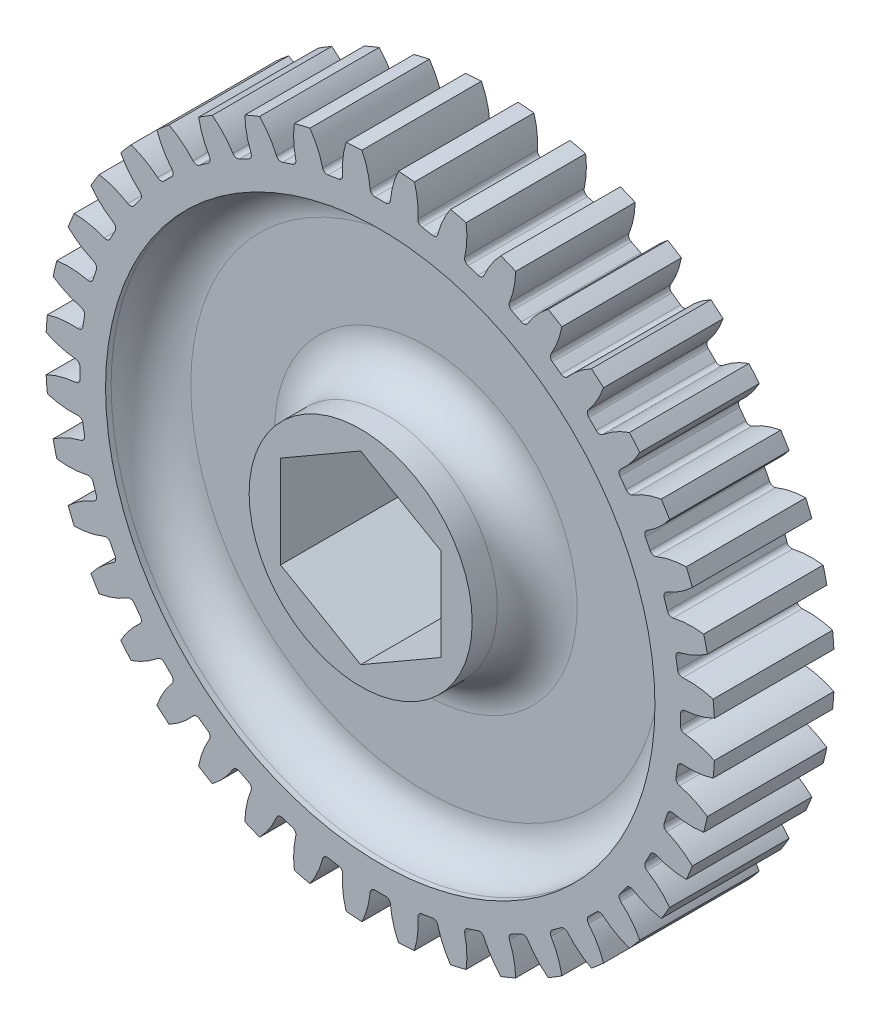
from build123d import *

# Parameters (mm, degrees)
CROQUIS1_R                 = 26.67
SALIENTE_EXTRUIR1_DEPTH    = 4.7625
CORTAR_EXTRUIR1_DEPTH      = 39.016564893
REDONDEO1_R                = 0.381028065
MATRIZC1_COUNT             = 40
REDONDEO1_OF_MATRIZC1_R    = 0.381028065
CROQUIS3_R                 = 8.89
SALIENTE_EXTRUIR2_DEPTH    = 6.3246
CORTAR_EXTRUIR2_DEPTH      = 39.188154981
CORTAR_EXTRUIR2_DEPTH_BACK = 39.188154981
CORTAR_EXTRUIR5_START      = -1.143
CROQUIS7_R                 = 21.8948
CROQUIS7_R_2               = 8.89
CORTAR_EXTRUIR5_DEPTH      = 38.045154981
REDONDEO2_R                = 3.175
REDONDEO2_OF_SIMETR_A1_R   = 3.175


with BuildPart() as part:
    # Croquis1 → Saliente-Extruir1 (new, symmetric)
    with BuildSketch(Plane.XY):
        Circle(CROQUIS1_R)
    extrude(amount=SALIENTE_EXTRUIR1_DEPTH, both=True)

    # Croquis2 → Cortar-Extruir1 (cut, symmetric)
    with BuildSketch(Plane.XY):
        with BuildLine():
            ThreePointArc((0.78662744, 23.917677819), (0, 23.93061), (-0.78662744, 23.917677819))
            ThreePointArc((-0.78662744, 23.917677819), (-0.97917411, 25.309112938), (-1.456570447, 26.630195315))
            ThreePointArc((-1.456570447, 26.630195315), (0, 26.67), (1.456570447, 26.630195315))
            ThreePointArc((1.456570447, 26.630195315), (0.97917411, 25.309112938), (0.78662744, 23.917677819))
        make_face()
    cortar_extruir1 = extrude(amount=CORTAR_EXTRUIR1_DEPTH, both=True, mode=Mode.SUBTRACT)

    # Redondeo1
    redondeo1_edges = [part.edges().sort_by_distance(p)[0] for p in [
        (0.78662744, 23.917677819, 0),
        (-0.78662744, 23.917677819, 0),
    ]]
    fillet(redondeo1_edges, radius=REDONDEO1_R)

    # MatrizC1: Cortar-Extruir1 ×40 about axis
    matrizc1_axis = Axis((0, 0, 4.7625), (0, 0, -1))
    for i in range(1, MATRIZC1_COUNT):
        add(cortar_extruir1.rotate(matrizc1_axis, i * 360 / MATRIZC1_COUNT), mode=Mode.SUBTRACT)

    # Redondeo1 of MatrizC1
    redondeo1_of_matrizc1_edges = [part.edges().sort_by_distance(p)[0] for p in [
        (4.518491885, 23.500155873, 0),
        (2.964606384, 23.746267158, 0),
        (8.139096065, 22.503982097, 0),
        (6.642841759, 22.990144591, 0),
        (11.559288687, 20.953685595, 0),
        (10.157508324, 21.667928365, 0),
        (14.694853258, 18.887439813, 0),
        (13.422063324, 19.81217583, 0),
        (17.468581773, 16.356122579, 0),
        (16.356122579, 17.468581773, 0),
        (19.81217583, 13.422063324, 0),
        (18.887439813, 14.694853258, 0),
        (21.667928365, 10.157508324, 0),
        (20.953685595, 11.559288687, 0),
        (22.990144591, 6.642841759, 0),
        (22.503982097, 8.139096065, 0),
        (23.746267158, 2.964606384, 0),
        (23.500155873, 4.518491885, 0),
        (23.917677819, -0.78662744, 0),
        (23.917677819, 0.78662744, 0),
        (23.500155873, -4.518491885, 0),
        (23.746267158, -2.964606384, 0),
        (22.503982097, -8.139096065, 0),
        (22.990144591, -6.642841759, 0),
        (20.953685595, -11.559288687, 0),
        (21.667928365, -10.157508324, 0),
        (18.887439813, -14.694853258, 0),
        (19.81217583, -13.422063324, 0),
        (16.356122579, -17.468581773, 0),
        (17.468581773, -16.356122579, 0),
        (13.422063324, -19.81217583, 0),
        (14.694853258, -18.887439813, 0),
        (10.157508324, -21.667928365, 0),
        (11.559288687, -20.953685595, 0),
        (6.642841759, -22.990144591, 0),
        (8.139096065, -22.503982097, 0),
        (2.964606384, -23.746267158, 0),
        (4.518491885, -23.500155873, 0),
        (-0.78662744, -23.917677819, 0),
        (0.78662744, -23.917677819, 0),
        (-4.518491885, -23.500155873, 0),
        (-2.964606384, -23.746267158, 0),
        (-8.139096065, -22.503982097, 0),
        (-6.642841759, -22.990144591, 0),
        (-11.559288687, -20.953685595, 0),
        (-10.157508324, -21.667928365, 0),
        (-14.694853258, -18.887439813, 0),
        (-13.422063324, -19.81217583, 0),
        (-17.468581773, -16.356122579, 0),
        (-16.356122579, -17.468581773, 0),
        (-19.81217583, -13.422063324, 0),
        (-18.887439813, -14.694853258, 0),
        (-21.667928365, -10.157508324, 0),
        (-20.953685595, -11.559288687, 0),
        (-22.990144591, -6.642841759, 0),
        (-22.503982097, -8.139096065, 0),
        (-23.746267158, -2.964606384, 0),
        (-23.500155873, -4.518491885, 0),
        (-23.917677819, 0.78662744, 0),
        (-23.917677819, -0.78662744, 0),
        (-23.500155873, 4.518491885, 0),
        (-23.746267158, 2.964606384, 0),
        (-22.503982097, 8.139096065, 0),
        (-22.990144591, 6.642841759, 0),
        (-20.953685595, 11.559288687, 0),
        (-21.667928365, 10.157508324, 0),
        (-18.887439813, 14.694853258, 0),
        (-19.81217583, 13.422063324, 0),
        (-16.356122579, 17.468581773, 0),
        (-17.468581773, 16.356122579, 0),
        (-13.422063324, 19.81217583, 0),
        (-14.694853258, 18.887439813, 0),
        (-10.157508324, 21.667928365, 0),
        (-11.559288687, 20.953685595, 0),
        (-6.642841759, 22.990144591, 0),
        (-8.139096065, 22.503982097, 0),
        (-2.964606384, 23.746267158, 0),
        (-4.518491885, 23.500155873, 0),
    ]]
    fillet(redondeo1_of_matrizc1_edges, radius=REDONDEO1_OF_MATRIZC1_R)

    # Croquis3 → Saliente-Extruir2 (add, symmetric)
    with BuildSketch(Plane.XY):
        Circle(CROQUIS3_R)
    extrude(amount=SALIENTE_EXTRUIR2_DEPTH, both=True)

    # Croquis4 → Cortar-Extruir2 (cut, two sides: drawn at the far end of the back side and taken through both)
    with BuildSketch(Plane.XY.offset(-CORTAR_EXTRUIR2_DEPTH_BACK)):
        Polygon((0, 7.376342509), (-6.3881, 3.688171255), (-6.3881, -3.688171255), (0, -7.376342509), (6.3881, -3.688171255), (6.3881, 3.688171255), align=None)
    extrude(amount=CORTAR_EXTRUIR2_DEPTH + CORTAR_EXTRUIR2_DEPTH_BACK, mode=Mode.SUBTRACT)

    # Croquis7 → Cortar-Extruir5 (cut, through all)
    with BuildSketch(Plane.XY.offset(CORTAR_EXTRUIR5_START)):
        Circle(CROQUIS7_R)
        Circle(CROQUIS7_R_2, mode=Mode.SUBTRACT)
    cortar_extruir5 = extrude(amount=-CORTAR_EXTRUIR5_DEPTH, mode=Mode.SUBTRACT)

    # Redondeo2
    redondeo2_edges = [part.edges().sort_by_distance(p)[0] for p in [
        (-8.89, 0, -1.143),
        (-21.8948, 0, -1.143),
    ]]
    fillet(redondeo2_edges, radius=REDONDEO2_R)

    # Simetría1: Cortar-Extruir5 across plane
    add(cortar_extruir5.mirror(Plane.XY), mode=Mode.SUBTRACT)

    # Redondeo2 of Simetría1
    redondeo2_of_simetr_a1_edges = [part.edges().sort_by_distance(p)[0] for p in [
        (-8.89, 0, 1.143),
        (-21.8948, 0, 1.143),
    ]]
    fillet(redondeo2_of_simetr_a1_edges, radius=REDONDEO2_OF_SIMETR_A1_R)


solid = part.part
